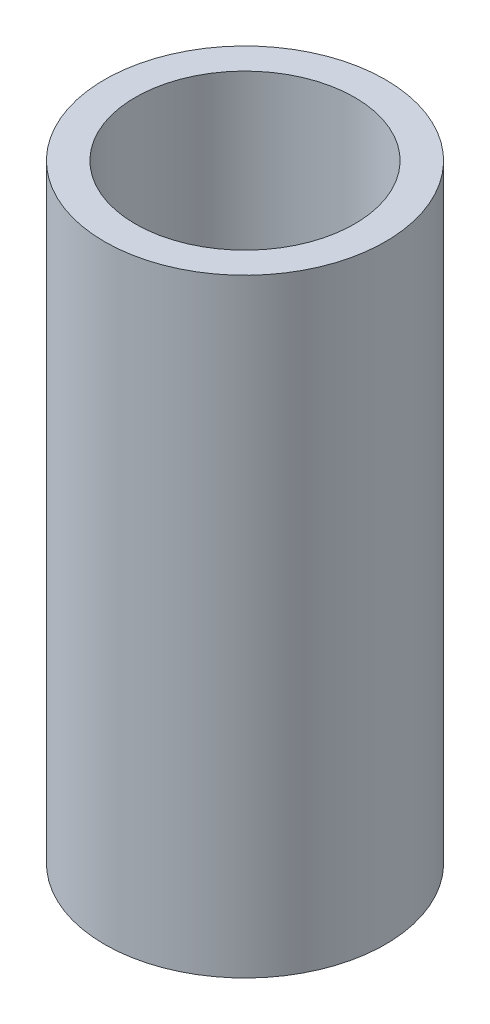
from build123d import *

# Parameters (mm, degrees)
SKETCH1_R           = 17.5
BOSS_EXTRUDE1_DEPTH = 75.840789227
SKETCH2_R           = 13.6699658
CUT_EXTRUDE1_DEPTH  = 80.776721608


with BuildPart() as part:
    # Sketch1 → Boss-Extrude1 (new body)
    with BuildSketch(Plane(origin=(0, 0, 0), x_dir=(1, 0, 0), z_dir=(0, 1, 0))):
        Circle(SKETCH1_R)
    extrude(amount=BOSS_EXTRUDE1_DEPTH)

    # Sketch2 → Cut-Extrude1 (cut, through all)
    with BuildSketch(Plane(origin=(0, 0, 0), x_dir=(1, 0, 0), z_dir=(0, 1, 0))):
        Circle(SKETCH2_R)
    extrude(amount=CUT_EXTRUDE1_DEPTH, mode=Mode.SUBTRACT)


solid = part.part
